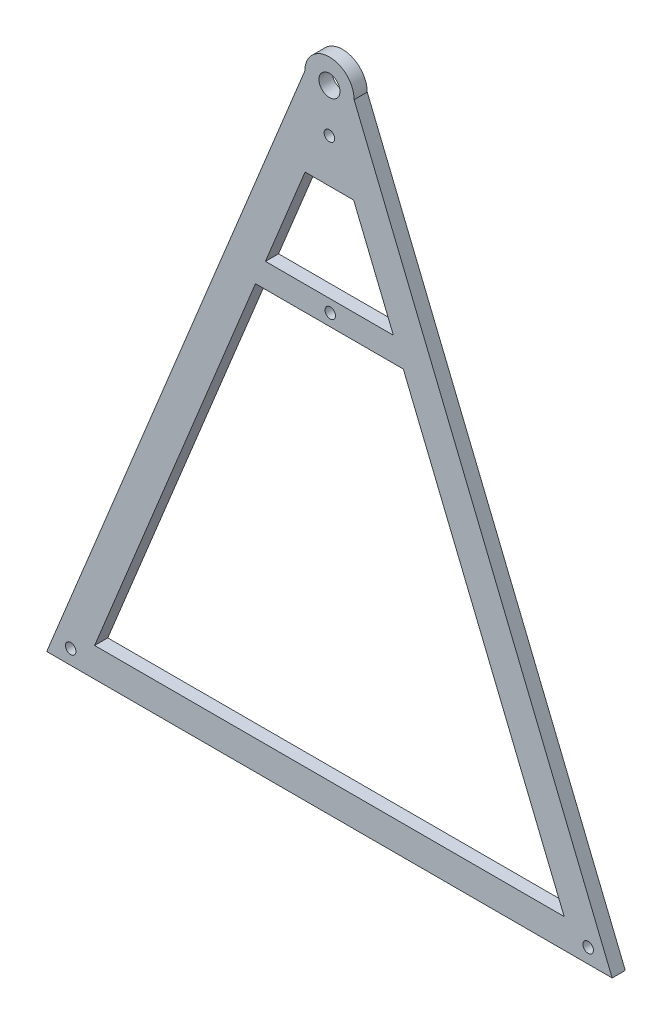
from build123d import *

# Parameters (mm, degrees)
SKETCH1_R           = 5.08
BOSS_EXTRUDE2_DEPTH = 6.35
SKETCH2_R           = 2.54
CUT_EXTRUDE1_DEPTH  = 6.35
SKETCH3_R           = 2.54
CUT_EXTRUDE2_DEPTH  = 6.35
SKETCH4_R           = 2.54
CUT_EXTRUDE3_DEPTH  = 6.35
BOSS_EXTRUDE4_DEPTH = 6.35
SKETCH6_R           = 2.54
CUT_EXTRUDE4_DEPTH  = 6.35


with BuildPart() as part:
    # Sketch1 → Boss-Extrude2 (new body)
    with BuildSketch(Plane.XY):
        with BuildLine():
            Line((136.770171448, -305.554470191), (11.941930891, 0))
            ThreePointArc((11.941930891, 0), (0, 11.941930891), (-11.941930891, 0))
            Line((-11.941930891, 0), (-136.770171448, -305.554470191))
            Line((-136.770171448, -305.554470191), (136.770171448, -305.554470191))
        make_face()
        Polygon((-11.770355206, -42.174693777), (11.728986278, -42.174693777), (113.552372545, -291.41789952), (-113.593741472, -291.41789952), align=None, mode=Mode.SUBTRACT)
        Circle(SKETCH1_R, mode=Mode.SUBTRACT)
    extrude(amount=BOSS_EXTRUDE2_DEPTH)

    # Sketch2 → Cut-Extrude1 (cut)
    with BuildSketch(Plane.XY.offset(6.35)):
        with Locations((125.161271996, -298.486184856)):
            Circle(SKETCH2_R)
    extrude(amount=-CUT_EXTRUDE1_DEPTH, mode=Mode.SUBTRACT)

    # Sketch3 → Cut-Extrude2 (cut)
    with BuildSketch(Plane.XY.offset(6.35)):
        with Locations((-125.18195646, -298.486184856)):
            Circle(SKETCH3_R)
    extrude(amount=-CUT_EXTRUDE2_DEPTH, mode=Mode.SUBTRACT)

    # Sketch4 → Cut-Extrude3 (cut)
    with BuildSketch(Plane.XY.offset(6.35)):
        with Locations((-0.010342232, -21.087346888)):
            Circle(SKETCH4_R)
    extrude(amount=-CUT_EXTRUDE3_DEPTH, mode=Mode.SUBTRACT)

    # Sketch5 → Boss-Extrude4 (add)
    with BuildSketch(Plane.XY.offset(6.35)):
        Polygon((-30.978629508, -89.19269268), (30.93726058, -89.19269268), (35.740250498, -100.949447668), (-35.781619426, -100.949447668), align=None)
    extrude(amount=-BOSS_EXTRUDE4_DEPTH)

    # Sketch6 → Cut-Extrude4 (cut)
    with BuildSketch(Plane.XY.offset(6.35)):
        with Locations((0.408650708, -95.111508528)):
            Circle(SKETCH6_R)
    extrude(amount=-CUT_EXTRUDE4_DEPTH, mode=Mode.SUBTRACT)


solid = part.part
